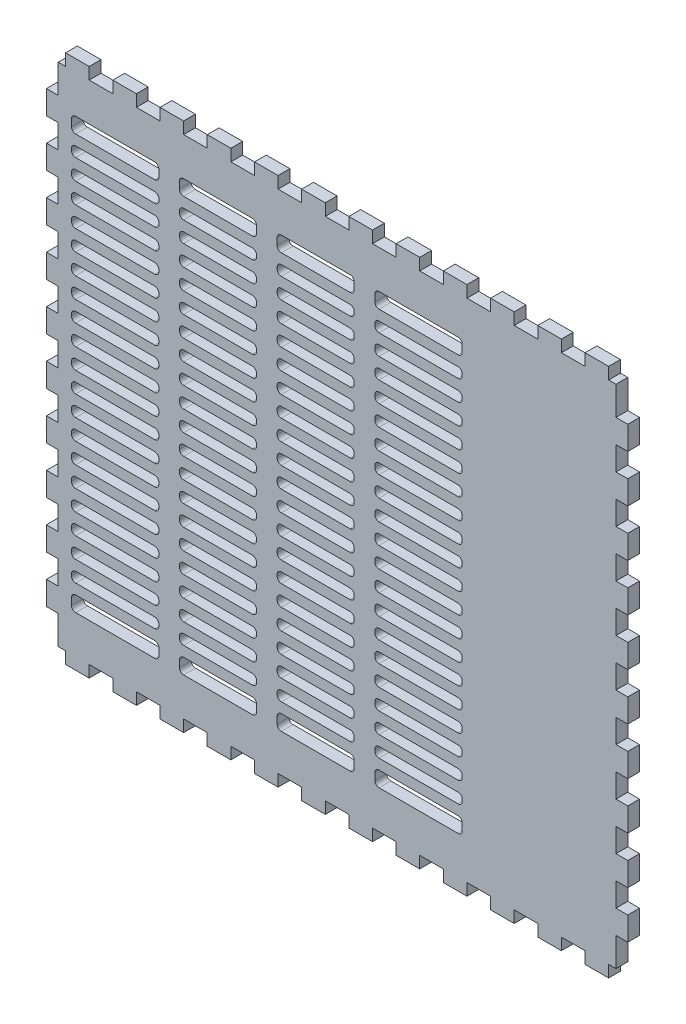
from build123d import *

# Parameters (mm, degrees)
BOSS_EXTRUDE1_DEPTH = 5.715
VENT1_DEPTH         = 5.715
FILLET1_R           = 2


# Read off the part's stored shape, not the designer's step: Vent1
with BuildPart() as part:
    # Model → Boss-Extrude1 (new body)
    with BuildSketch(Plane.XY):
        Polygon((584.69022, 28.91536), (588.24368, 28.91536), (588.24368, 23.2006394), (599.67622, 23.2006394), (599.67622, 28.91536), (611.10622, 28.91536), (611.10622, 23.2006394), (622.53622, 23.2006394), (622.53622, 28.91536), (633.96622, 28.91536), (633.96622, 23.2006394), (645.39368, 23.2006394), (645.39368, 28.91536), (656.82622, 28.91536), (656.82622, 23.2006394), (668.25622, 23.2006394), (668.25622, 28.91536), (679.68622, 28.91536), (679.68622, 23.2006394), (691.11622, 23.2006394), (691.11622, 28.91536), (702.54368, 28.91536), (702.54368, 23.2006394), (713.97622, 23.2006394), (713.97622, 28.91536), (725.40622, 28.91536), (725.40622, 23.2006394), (736.83622, 23.2006394), (736.83622, 28.91536), (748.26622, 28.91536), (748.26622, 23.2006394), (759.69368, 23.2006394), (759.69368, 28.91536), (771.12622, 28.91536), (771.12622, 23.2006394), (782.55622, 23.2006394), (782.55622, 28.91536), (793.98622, 28.91536), (793.98622, 23.2006394), (805.41622, 23.2006394), (805.41622, 28.91536), (816.84368, 28.91536), (816.84368, 23.2006394), (828.27622, 23.2006394), (828.27622, 28.91536), (839.70622, 28.91536), (839.70622, 23.2006394), (851.13622, 23.2006394), (851.13622, 28.91536), (854.68968, 28.91536), (854.68968, 42.83075), (860.40468, 42.83075), (860.40468, 54.260496), (854.68968, 54.260496), (854.68968, 65.691004), (860.40468, 65.691004), (860.40468, 77.120496), (854.68968, 77.120496), (854.68968, 88.549988), (860.40468, 88.549988), (860.40468, 99.98075), (854.68968, 99.98075), (854.68968, 111.410496), (860.40468, 111.410496), (860.40468, 122.841004), (854.68968, 122.841004), (854.68968, 134.270496), (860.40468, 134.270496), (860.40468, 145.699988), (854.68968, 145.699988), (854.68968, 157.13075), (860.40468, 157.13075), (860.40468, 168.560496), (854.68968, 168.560496), (854.68968, 179.991004), (860.40468, 179.991004), (860.40468, 191.420496), (854.68968, 191.420496), (854.68968, 202.849988), (860.40468, 202.849988), (860.40468, 214.28075), (854.68968, 214.28075), (854.68968, 225.710496), (860.40468, 225.710496), (860.40468, 237.141004), (854.68968, 237.141004), (854.68968, 248.570496), (860.40468, 248.570496), (860.40468, 259.99948), (854.68968, 259.99948), (854.68968, 273.91614), (851.13622, 273.91614), (851.13622, 279.63114), (839.70622, 279.63114), (839.70622, 273.91614), (828.27622, 273.91614), (828.27622, 279.63114), (816.84368, 279.63114), (816.84368, 273.91614), (805.41622, 273.91614), (805.41622, 279.63114), (793.98622, 279.63114), (793.98622, 273.91614), (782.55622, 273.91614), (782.55622, 279.63114), (771.12622, 279.63114), (771.12622, 273.91614), (759.69368, 273.91614), (759.69368, 279.63114), (748.26622, 279.63114), (748.26622, 273.91614), (736.83622, 273.91614), (736.83622, 279.63114), (725.40622, 279.63114), (725.40622, 273.91614), (713.97622, 273.91614), (713.97622, 279.63114), (702.54368, 279.63114), (702.54368, 273.91614), (691.11622, 273.91614), (691.11622, 279.63114), (679.68622, 279.63114), (679.68622, 273.91614), (668.25622, 273.91614), (668.25622, 279.63114), (656.82622, 279.63114), (656.82622, 273.91614), (645.39368, 273.91614), (645.39368, 279.63114), (633.96622, 279.63114), (633.96622, 273.91614), (622.53622, 273.91614), (622.53622, 279.63114), (611.10622, 279.63114), (611.10622, 273.91614), (599.67622, 273.91614), (599.67622, 279.63114), (588.24368, 279.63114), (588.24368, 273.91614), (584.69022, 273.91614), (584.69022, 259.99948), (578.97522, 259.99948), (578.97522, 248.570496), (584.69022, 248.570496), (584.69022, 237.141004), (578.97522, 237.141004), (578.97522, 225.710496), (584.69022, 225.710496), (584.69022, 214.28075), (578.97522, 214.28075), (578.97522, 202.849988), (584.69022, 202.849988), (584.69022, 191.420496), (578.97522, 191.420496), (578.97522, 179.991004), (584.69022, 179.991004), (584.69022, 168.560496), (578.97522, 168.560496), (578.97522, 157.13075), (584.69022, 157.13075), (584.69022, 145.699988), (578.97522, 145.699988), (578.97522, 134.270496), (584.69022, 134.270496), (584.69022, 122.841004), (578.97522, 122.841004), (578.97522, 111.410496), (584.69022, 111.410496), (584.69022, 99.98075), (578.97522, 99.98075), (578.97522, 88.549988), (584.69022, 88.549988), (584.69022, 77.120496), (578.97522, 77.120496), (578.97522, 65.691004), (584.69022, 65.691004), (584.69022, 54.260496), (578.97522, 54.260496), (578.97522, 42.83075), (584.69022, 42.83075), align=None)
    extrude(amount=BOSS_EXTRUDE1_DEPTH)

    # Vent1 outline → Vent1 (cut)
    with BuildSketch(Plane.XY):
        with BuildLine():
            ThreePointArc((633.397453047, 253.451283906), (632.811666609, 254.865497468), (631.397453047, 255.451283906))
            Line((631.397453047, 255.451283906), (591.104686094, 255.451283906))
            Line((591.104686094, 255.451283906), (591.104686094, 250.04313782))
            ThreePointArc((591.104686094, 250.04313782), (591.690472532, 248.628924257), (593.104686094, 248.04313782))
            Line((593.104686094, 248.04313782), (631.397453047, 248.04313782))
            ThreePointArc((631.397453047, 248.04313782), (632.811666609, 248.628924257), (633.397453047, 250.04313782))
            Line((633.397453047, 250.04313782), (633.397453047, 253.451283906))
        make_face()
        with BuildLine():
            ThreePointArc((680.69022, 253.451283906), (680.104433562, 254.865497468), (678.69022, 255.451283906))
            Line((678.69022, 255.451283906), (645.397453047, 255.451283906))
            ThreePointArc((645.397453047, 255.451283906), (643.983239485, 254.865497468), (643.397453047, 253.451283906))
            Line((643.397453047, 253.451283906), (643.397453047, 250.04313782))
            ThreePointArc((643.397453047, 250.04313782), (643.983239485, 248.628924257), (645.397453047, 248.04313782))
            Line((645.397453047, 248.04313782), (678.69022, 248.04313782))
            ThreePointArc((678.69022, 248.04313782), (680.104433562, 248.628924257), (680.69022, 250.04313782))
            Line((680.69022, 250.04313782), (680.69022, 253.451283906))
        make_face()
        with BuildLine():
            ThreePointArc((727.982986953, 253.451283906), (727.397200515, 254.865497468), (725.982986953, 255.451283906))
            Line((725.982986953, 255.451283906), (692.69022, 255.451283906))
            ThreePointArc((692.69022, 255.451283906), (691.276006438, 254.865497468), (690.69022, 253.451283906))
            Line((690.69022, 253.451283906), (690.69022, 250.04313782))
            ThreePointArc((690.69022, 250.04313782), (691.276006437, 248.628924257), (692.69022, 248.04313782))
            Line((692.69022, 248.04313782), (725.982986953, 248.04313782))
            ThreePointArc((725.982986953, 248.04313782), (727.397200516, 248.628924257), (727.982986953, 250.04313782))
            Line((727.982986953, 250.04313782), (727.982986953, 253.451283906))
        make_face()
        with BuildLine():
            Line((780.275753906, 250.04313782), (780.275753906, 255.451283906))
            Line((780.275753906, 255.451283906), (739.982986953, 255.451283906))
            ThreePointArc((739.982986953, 255.451283906), (738.568773391, 254.865497468), (737.982986953, 253.451283906))
            Line((737.982986953, 253.451283906), (737.982986953, 250.04313782))
            ThreePointArc((737.982986953, 250.04313782), (738.568773391, 248.628924257), (739.982986953, 248.04313782))
            Line((739.982986953, 248.04313782), (778.275753906, 248.04313782))
            ThreePointArc((778.275753906, 248.04313782), (779.689967468, 248.628924257), (780.275753906, 250.04313782))
        make_face()
        with BuildLine():
            Line((591.104686094, 52.78836218), (591.104686094, 47.380216094))
            Line((591.104686094, 47.380216094), (631.397453047, 47.380216094))
            ThreePointArc((631.397453047, 47.380216094), (632.811666609, 47.966002532), (633.397453047, 49.380216094))
            Line((633.397453047, 49.380216094), (633.397453047, 52.78836218))
            ThreePointArc((633.397453047, 52.78836218), (632.811666609, 54.202575742), (631.397453047, 54.78836218))
            Line((631.397453047, 54.78836218), (593.104686094, 54.78836218))
            ThreePointArc((593.104686094, 54.78836218), (591.690472532, 54.202575743), (591.104686094, 52.78836218))
        make_face()
        with BuildLine():
            ThreePointArc((643.397453047, 49.380216094), (643.983239485, 47.966002532), (645.397453047, 47.380216094))
            Line((645.397453047, 47.380216094), (678.69022, 47.380216094))
            ThreePointArc((678.69022, 47.380216094), (680.104433562, 47.966002532), (680.69022, 49.380216094))
            Line((680.69022, 49.380216094), (680.69022, 52.78836218))
            ThreePointArc((680.69022, 52.78836218), (680.104433562, 54.202575743), (678.69022, 54.78836218))
            Line((678.69022, 54.78836218), (645.397453047, 54.78836218))
            ThreePointArc((645.397453047, 54.78836218), (643.983239485, 54.202575742), (643.397453047, 52.78836218))
            Line((643.397453047, 52.78836218), (643.397453047, 49.380216094))
        make_face()
        with BuildLine():
            ThreePointArc((690.69022, 49.380216094), (691.276006438, 47.966002532), (692.69022, 47.380216094))
            Line((692.69022, 47.380216094), (725.982986953, 47.380216094))
            ThreePointArc((725.982986953, 47.380216094), (727.397200515, 47.966002532), (727.982986953, 49.380216094))
            Line((727.982986953, 49.380216094), (727.982986953, 52.78836218))
            ThreePointArc((727.982986953, 52.78836218), (727.397200516, 54.202575742), (725.982986953, 54.78836218))
            Line((725.982986953, 54.78836218), (692.69022, 54.78836218))
            ThreePointArc((692.69022, 54.78836218), (691.276006437, 54.202575742), (690.69022, 52.78836218))
            Line((690.69022, 52.78836218), (690.69022, 49.380216094))
        make_face()
        with BuildLine():
            ThreePointArc((737.982986953, 49.380216094), (738.568773391, 47.966002532), (739.982986953, 47.380216094))
            Line((739.982986953, 47.380216094), (780.275753906, 47.380216094))
            Line((780.275753906, 47.380216094), (780.275753906, 52.78836218))
            ThreePointArc((780.275753906, 52.78836218), (779.689967468, 54.202575742), (778.275753906, 54.78836218))
            Line((778.275753906, 54.78836218), (739.982986953, 54.78836218))
            ThreePointArc((739.982986953, 54.78836218), (738.568773391, 54.202575742), (737.982986953, 52.78836218))
            Line((737.982986953, 52.78836218), (737.982986953, 49.380216094))
        make_face()
        with BuildLine():
            Line((593.104686094, 59.78836218), (631.397453047, 59.78836218))
            ThreePointArc((631.397453047, 59.78836218), (632.811666609, 60.374148618), (633.397453047, 61.78836218))
            Line((633.397453047, 61.78836218), (633.397453047, 62.696508267))
            ThreePointArc((633.397453047, 62.696508267), (632.811666609, 64.110721829), (631.397453047, 64.696508267))
            Line((631.397453047, 64.696508267), (593.104686094, 64.696508267))
            ThreePointArc((593.104686094, 64.696508267), (591.690472532, 64.110721829), (591.104686094, 62.696508267))
            Line((591.104686094, 62.696508267), (591.104686094, 61.78836218))
            ThreePointArc((591.104686094, 61.78836218), (591.690472532, 60.374148618), (593.104686094, 59.78836218))
        make_face()
        with BuildLine():
            Line((645.397453047, 59.78836218), (678.69022, 59.78836218))
            ThreePointArc((678.69022, 59.78836218), (680.104433562, 60.374148618), (680.69022, 61.78836218))
            Line((680.69022, 61.78836218), (680.69022, 62.696508267))
            ThreePointArc((680.69022, 62.696508267), (680.104433562, 64.110721829), (678.69022, 64.696508267))
            Line((678.69022, 64.696508267), (645.397453047, 64.696508267))
            ThreePointArc((645.397453047, 64.696508267), (643.983239485, 64.110721829), (643.397453047, 62.696508267))
            Line((643.397453047, 62.696508267), (643.397453047, 61.78836218))
            ThreePointArc((643.397453047, 61.78836218), (643.983239485, 60.374148618), (645.397453047, 59.78836218))
        make_face()
        with BuildLine():
            Line((692.69022, 59.78836218), (725.982986953, 59.78836218))
            ThreePointArc((725.982986953, 59.78836218), (727.397200515, 60.374148618), (727.982986953, 61.78836218))
            Line((727.982986953, 61.78836218), (727.982986953, 62.696508267))
            ThreePointArc((727.982986953, 62.696508267), (727.397200515, 64.110721829), (725.982986953, 64.696508267))
            Line((725.982986953, 64.696508267), (692.69022, 64.696508267))
            ThreePointArc((692.69022, 64.696508267), (691.276006438, 64.110721829), (690.69022, 62.696508267))
            Line((690.69022, 62.696508267), (690.69022, 61.78836218))
            ThreePointArc((690.69022, 61.78836218), (691.276006438, 60.374148618), (692.69022, 59.78836218))
        make_face()
        with BuildLine():
            Line((739.982986953, 59.78836218), (778.275753906, 59.78836218))
            ThreePointArc((778.275753906, 59.78836218), (779.689967468, 60.374148618), (780.275753906, 61.78836218))
            Line((780.275753906, 61.78836218), (780.275753906, 62.696508267))
            ThreePointArc((780.275753906, 62.696508267), (779.689967468, 64.110721829), (778.275753906, 64.696508267))
            Line((778.275753906, 64.696508267), (739.982986953, 64.696508267))
            ThreePointArc((739.982986953, 64.696508267), (738.568773391, 64.110721829), (737.982986953, 62.696508267))
            Line((737.982986953, 62.696508267), (737.982986953, 61.78836218))
            ThreePointArc((737.982986953, 61.78836218), (738.568773391, 60.374148618), (739.982986953, 59.78836218))
        make_face()
        with BuildLine():
            Line((593.104686094, 69.696508267), (631.397453047, 69.696508267))
            ThreePointArc((631.397453047, 69.696508267), (632.811666609, 70.282294705), (633.397453047, 71.696508267))
            Line((633.397453047, 71.696508267), (633.397453047, 72.604654353))
            ThreePointArc((633.397453047, 72.604654353), (632.811666609, 74.018867915), (631.397453047, 74.604654353))
            Line((631.397453047, 74.604654353), (593.104686094, 74.604654353))
            ThreePointArc((593.104686094, 74.604654353), (591.690472532, 74.018867915), (591.104686094, 72.604654353))
            Line((591.104686094, 72.604654353), (591.104686094, 71.696508267))
            ThreePointArc((591.104686094, 71.696508267), (591.690472532, 70.282294704), (593.104686094, 69.696508267))
        make_face()
        with BuildLine():
            Line((645.397453047, 69.696508267), (678.69022, 69.696508267))
            ThreePointArc((678.69022, 69.696508267), (680.104433562, 70.282294704), (680.69022, 71.696508267))
            Line((680.69022, 71.696508267), (680.69022, 72.604654353))
            ThreePointArc((680.69022, 72.604654353), (680.104433562, 74.018867915), (678.69022, 74.604654353))
            Line((678.69022, 74.604654353), (645.397453047, 74.604654353))
            ThreePointArc((645.397453047, 74.604654353), (643.983239485, 74.018867915), (643.397453047, 72.604654353))
            Line((643.397453047, 72.604654353), (643.397453047, 71.696508267))
            ThreePointArc((643.397453047, 71.696508267), (643.983239485, 70.282294705), (645.397453047, 69.696508267))
        make_face()
        with BuildLine():
            Line((692.69022, 69.696508267), (725.982986953, 69.696508267))
            ThreePointArc((725.982986953, 69.696508267), (727.397200516, 70.282294705), (727.982986953, 71.696508267))
            Line((727.982986953, 71.696508267), (727.982986953, 72.604654353))
            ThreePointArc((727.982986953, 72.604654353), (727.397200515, 74.018867915), (725.982986953, 74.604654353))
            Line((725.982986953, 74.604654353), (692.69022, 74.604654353))
            ThreePointArc((692.69022, 74.604654353), (691.276006438, 74.018867915), (690.69022, 72.604654353))
            Line((690.69022, 72.604654353), (690.69022, 71.696508267))
            ThreePointArc((690.69022, 71.696508267), (691.276006437, 70.282294705), (692.69022, 69.696508267))
        make_face()
        with BuildLine():
            Line((739.982986953, 69.696508267), (778.275753906, 69.696508267))
            ThreePointArc((778.275753906, 69.696508267), (779.689967468, 70.282294705), (780.275753906, 71.696508267))
            Line((780.275753906, 71.696508267), (780.275753906, 72.604654353))
            ThreePointArc((780.275753906, 72.604654353), (779.689967468, 74.018867915), (778.275753906, 74.604654353))
            Line((778.275753906, 74.604654353), (739.982986953, 74.604654353))
            ThreePointArc((739.982986953, 74.604654353), (738.568773391, 74.018867915), (737.982986953, 72.604654353))
            Line((737.982986953, 72.604654353), (737.982986953, 71.696508267))
            ThreePointArc((737.982986953, 71.696508267), (738.568773391, 70.282294705), (739.982986953, 69.696508267))
        make_face()
        with BuildLine():
            Line((593.104686094, 79.604654353), (631.397453047, 79.604654353))
            ThreePointArc((631.397453047, 79.604654353), (632.811666609, 80.190440791), (633.397453047, 81.604654353))
            Line((633.397453047, 81.604654353), (633.397453047, 82.512800439))
            ThreePointArc((633.397453047, 82.512800439), (632.811666609, 83.927014001), (631.397453047, 84.512800439))
            Line((631.397453047, 84.512800439), (593.104686094, 84.512800439))
            ThreePointArc((593.104686094, 84.512800439), (591.690472532, 83.927014002), (591.104686094, 82.512800439))
            Line((591.104686094, 82.512800439), (591.104686094, 81.604654353))
            ThreePointArc((591.104686094, 81.604654353), (591.690472532, 80.190440791), (593.104686094, 79.604654353))
        make_face()
        with BuildLine():
            Line((645.397453047, 79.604654353), (678.69022, 79.604654353))
            ThreePointArc((678.69022, 79.604654353), (680.104433562, 80.190440791), (680.69022, 81.604654353))
            Line((680.69022, 81.604654353), (680.69022, 82.512800439))
            ThreePointArc((680.69022, 82.512800439), (680.104433562, 83.927014002), (678.69022, 84.512800439))
            Line((678.69022, 84.512800439), (645.397453047, 84.512800439))
            ThreePointArc((645.397453047, 84.512800439), (643.983239485, 83.927014001), (643.397453047, 82.512800439))
            Line((643.397453047, 82.512800439), (643.397453047, 81.604654353))
            ThreePointArc((643.397453047, 81.604654353), (643.983239485, 80.190440791), (645.397453047, 79.604654353))
        make_face()
        with BuildLine():
            Line((692.69022, 79.604654353), (725.982986953, 79.604654353))
            ThreePointArc((725.982986953, 79.604654353), (727.397200515, 80.190440791), (727.982986953, 81.604654353))
            Line((727.982986953, 81.604654353), (727.982986953, 82.512800439))
            ThreePointArc((727.982986953, 82.512800439), (727.397200516, 83.927014001), (725.982986953, 84.512800439))
            Line((725.982986953, 84.512800439), (692.69022, 84.512800439))
            ThreePointArc((692.69022, 84.512800439), (691.276006437, 83.927014001), (690.69022, 82.512800439))
            Line((690.69022, 82.512800439), (690.69022, 81.604654353))
            ThreePointArc((690.69022, 81.604654353), (691.276006438, 80.190440791), (692.69022, 79.604654353))
        make_face()
        with BuildLine():
            Line((739.982986953, 79.604654353), (778.275753906, 79.604654353))
            ThreePointArc((778.275753906, 79.604654353), (779.689967468, 80.190440791), (780.275753906, 81.604654353))
            Line((780.275753906, 81.604654353), (780.275753906, 82.512800439))
            ThreePointArc((780.275753906, 82.512800439), (779.689967468, 83.927014001), (778.275753906, 84.512800439))
            Line((778.275753906, 84.512800439), (739.982986953, 84.512800439))
            ThreePointArc((739.982986953, 84.512800439), (738.568773391, 83.927014001), (737.982986953, 82.512800439))
            Line((737.982986953, 82.512800439), (737.982986953, 81.604654353))
            ThreePointArc((737.982986953, 81.604654353), (738.568773391, 80.190440791), (739.982986953, 79.604654353))
        make_face()
        with BuildLine():
            Line((593.104686094, 89.512800439), (631.397453047, 89.512800439))
            ThreePointArc((631.397453047, 89.512800439), (632.811666609, 90.098586877), (633.397453047, 91.512800439))
            Line((633.397453047, 91.512800439), (633.397453047, 92.420946525))
            ThreePointArc((633.397453047, 92.420946525), (632.811666609, 93.835160087), (631.397453047, 94.420946525))
            Line((631.397453047, 94.420946525), (593.104686094, 94.420946525))
            ThreePointArc((593.104686094, 94.420946525), (591.690472532, 93.835160088), (591.104686094, 92.420946525))
            Line((591.104686094, 92.420946525), (591.104686094, 91.512800439))
            ThreePointArc((591.104686094, 91.512800439), (591.690472532, 90.098586877), (593.104686094, 89.512800439))
        make_face()
        with BuildLine():
            Line((645.397453047, 89.512800439), (678.69022, 89.512800439))
            ThreePointArc((678.69022, 89.512800439), (680.104433562, 90.098586877), (680.69022, 91.512800439))
            Line((680.69022, 91.512800439), (680.69022, 92.420946525))
            ThreePointArc((680.69022, 92.420946525), (680.104433562, 93.835160088), (678.69022, 94.420946525))
            Line((678.69022, 94.420946525), (645.397453047, 94.420946525))
            ThreePointArc((645.397453047, 94.420946525), (643.983239485, 93.835160087), (643.397453047, 92.420946525))
            Line((643.397453047, 92.420946525), (643.397453047, 91.512800439))
            ThreePointArc((643.397453047, 91.512800439), (643.983239485, 90.098586877), (645.397453047, 89.512800439))
        make_face()
        with BuildLine():
            Line((692.69022, 89.512800439), (725.982986953, 89.512800439))
            ThreePointArc((725.982986953, 89.512800439), (727.397200515, 90.098586877), (727.982986953, 91.512800439))
            Line((727.982986953, 91.512800439), (727.982986953, 92.420946525))
            ThreePointArc((727.982986953, 92.420946525), (727.397200516, 93.835160087), (725.982986953, 94.420946525))
            Line((725.982986953, 94.420946525), (692.69022, 94.420946525))
            ThreePointArc((692.69022, 94.420946525), (691.276006437, 93.835160087), (690.69022, 92.420946525))
            Line((690.69022, 92.420946525), (690.69022, 91.512800439))
            ThreePointArc((690.69022, 91.512800439), (691.276006438, 90.098586877), (692.69022, 89.512800439))
        make_face()
        with BuildLine():
            Line((739.982986953, 89.512800439), (778.275753906, 89.512800439))
            ThreePointArc((778.275753906, 89.512800439), (779.689967468, 90.098586877), (780.275753906, 91.512800439))
            Line((780.275753906, 91.512800439), (780.275753906, 92.420946525))
            ThreePointArc((780.275753906, 92.420946525), (779.689967468, 93.835160087), (778.275753906, 94.420946525))
            Line((778.275753906, 94.420946525), (739.982986953, 94.420946525))
            ThreePointArc((739.982986953, 94.420946525), (738.568773391, 93.835160087), (737.982986953, 92.420946525))
            Line((737.982986953, 92.420946525), (737.982986953, 91.512800439))
            ThreePointArc((737.982986953, 91.512800439), (738.568773391, 90.098586877), (739.982986953, 89.512800439))
        make_face()
        with BuildLine():
            Line((593.104686094, 99.420946525), (631.397453047, 99.420946525))
            ThreePointArc((631.397453047, 99.420946525), (632.811666609, 100.006732963), (633.397453047, 101.420946525))
            Line((633.397453047, 101.420946525), (633.397453047, 102.329092612))
            ThreePointArc((633.397453047, 102.329092612), (632.811666609, 103.743306174), (631.397453047, 104.329092612))
            Line((631.397453047, 104.329092612), (593.104686094, 104.329092612))
            ThreePointArc((593.104686094, 104.329092612), (591.690472532, 103.743306174), (591.104686094, 102.329092612))
            Line((591.104686094, 102.329092612), (591.104686094, 101.420946525))
            ThreePointArc((591.104686094, 101.420946525), (591.690472532, 100.006732963), (593.104686094, 99.420946525))
        make_face()
        with BuildLine():
            Line((645.397453047, 99.420946525), (678.69022, 99.420946525))
            ThreePointArc((678.69022, 99.420946525), (680.104433562, 100.006732963), (680.69022, 101.420946525))
            Line((680.69022, 101.420946525), (680.69022, 102.329092612))
            ThreePointArc((680.69022, 102.329092612), (680.104433562, 103.743306174), (678.69022, 104.329092612))
            Line((678.69022, 104.329092612), (645.397453047, 104.329092612))
            ThreePointArc((645.397453047, 104.329092612), (643.983239485, 103.743306174), (643.397453047, 102.329092612))
            Line((643.397453047, 102.329092612), (643.397453047, 101.420946525))
            ThreePointArc((643.397453047, 101.420946525), (643.983239485, 100.006732963), (645.397453047, 99.420946525))
        make_face()
        with BuildLine():
            Line((692.69022, 99.420946525), (725.982986953, 99.420946525))
            ThreePointArc((725.982986953, 99.420946525), (727.397200515, 100.006732963), (727.982986953, 101.420946525))
            Line((727.982986953, 101.420946525), (727.982986953, 102.329092612))
            ThreePointArc((727.982986953, 102.329092612), (727.397200515, 103.743306174), (725.982986953, 104.329092612))
            Line((725.982986953, 104.329092612), (692.69022, 104.329092612))
            ThreePointArc((692.69022, 104.329092612), (691.276006438, 103.743306174), (690.69022, 102.329092612))
            Line((690.69022, 102.329092612), (690.69022, 101.420946525))
            ThreePointArc((690.69022, 101.420946525), (691.276006438, 100.006732963), (692.69022, 99.420946525))
        make_face()
        with BuildLine():
            Line((739.982986953, 99.420946525), (778.275753906, 99.420946525))
            ThreePointArc((778.275753906, 99.420946525), (779.689967468, 100.006732963), (780.275753906, 101.420946525))
            Line((780.275753906, 101.420946525), (780.275753906, 102.329092612))
            ThreePointArc((780.275753906, 102.329092612), (779.689967468, 103.743306174), (778.275753906, 104.329092612))
            Line((778.275753906, 104.329092612), (739.982986953, 104.329092612))
            ThreePointArc((739.982986953, 104.329092612), (738.568773391, 103.743306174), (737.982986953, 102.329092612))
            Line((737.982986953, 102.329092612), (737.982986953, 101.420946525))
            ThreePointArc((737.982986953, 101.420946525), (738.568773391, 100.006732963), (739.982986953, 99.420946525))
        make_face()
        with BuildLine():
            Line((593.104686094, 109.329092612), (631.397453047, 109.329092612))
            ThreePointArc((631.397453047, 109.329092612), (632.811666609, 109.91487905), (633.397453047, 111.329092612))
            Line((633.397453047, 111.329092612), (633.397453047, 112.237238698))
            ThreePointArc((633.397453047, 112.237238698), (632.811666609, 113.65145226), (631.397453047, 114.237238698))
            Line((631.397453047, 114.237238698), (593.104686094, 114.237238698))
            ThreePointArc((593.104686094, 114.237238698), (591.690472532, 113.65145226), (591.104686094, 112.237238698))
            Line((591.104686094, 112.237238698), (591.104686094, 111.329092612))
            ThreePointArc((591.104686094, 111.329092612), (591.690472532, 109.914879049), (593.104686094, 109.329092612))
        make_face()
        with BuildLine():
            Line((645.397453047, 109.329092612), (678.69022, 109.329092612))
            ThreePointArc((678.69022, 109.329092612), (680.104433562, 109.914879049), (680.69022, 111.329092612))
            Line((680.69022, 111.329092612), (680.69022, 112.237238698))
            ThreePointArc((680.69022, 112.237238698), (680.104433562, 113.65145226), (678.69022, 114.237238698))
            Line((678.69022, 114.237238698), (645.397453047, 114.237238698))
            ThreePointArc((645.397453047, 114.237238698), (643.983239485, 113.65145226), (643.397453047, 112.237238698))
            Line((643.397453047, 112.237238698), (643.397453047, 111.329092612))
            ThreePointArc((643.397453047, 111.329092612), (643.983239485, 109.91487905), (645.397453047, 109.329092612))
        make_face()
        with BuildLine():
            Line((692.69022, 109.329092612), (725.982986953, 109.329092612))
            ThreePointArc((725.982986953, 109.329092612), (727.397200516, 109.91487905), (727.982986953, 111.329092612))
            Line((727.982986953, 111.329092612), (727.982986953, 112.237238698))
            ThreePointArc((727.982986953, 112.237238698), (727.397200515, 113.65145226), (725.982986953, 114.237238698))
            Line((725.982986953, 114.237238698), (692.69022, 114.237238698))
            ThreePointArc((692.69022, 114.237238698), (691.276006438, 113.65145226), (690.69022, 112.237238698))
            Line((690.69022, 112.237238698), (690.69022, 111.329092612))
            ThreePointArc((690.69022, 111.329092612), (691.276006437, 109.91487905), (692.69022, 109.329092612))
        make_face()
        with BuildLine():
            Line((739.982986953, 109.329092612), (778.275753906, 109.329092612))
            ThreePointArc((778.275753906, 109.329092612), (779.689967468, 109.91487905), (780.275753906, 111.329092612))
            Line((780.275753906, 111.329092612), (780.275753906, 112.237238698))
            ThreePointArc((780.275753906, 112.237238698), (779.689967468, 113.65145226), (778.275753906, 114.237238698))
            Line((778.275753906, 114.237238698), (739.982986953, 114.237238698))
            ThreePointArc((739.982986953, 114.237238698), (738.568773391, 113.65145226), (737.982986953, 112.237238698))
            Line((737.982986953, 112.237238698), (737.982986953, 111.329092612))
            ThreePointArc((737.982986953, 111.329092612), (738.568773391, 109.91487905), (739.982986953, 109.329092612))
        make_face()
        with BuildLine():
            Line((593.104686094, 119.237238698), (631.397453047, 119.237238698))
            ThreePointArc((631.397453047, 119.237238698), (632.811666609, 119.823025136), (633.397453047, 121.237238698))
            Line((633.397453047, 121.237238698), (633.397453047, 122.145384784))
            ThreePointArc((633.397453047, 122.145384784), (632.811666609, 123.559598346), (631.397453047, 124.145384784))
            Line((631.397453047, 124.145384784), (593.104686094, 124.145384784))
            ThreePointArc((593.104686094, 124.145384784), (591.690472532, 123.559598347), (591.104686094, 122.145384784))
            Line((591.104686094, 122.145384784), (591.104686094, 121.237238698))
            ThreePointArc((591.104686094, 121.237238698), (591.690472532, 119.823025136), (593.104686094, 119.237238698))
        make_face()
        with BuildLine():
            Line((645.397453047, 119.237238698), (678.69022, 119.237238698))
            ThreePointArc((678.69022, 119.237238698), (680.104433562, 119.823025136), (680.69022, 121.237238698))
            Line((680.69022, 121.237238698), (680.69022, 122.145384784))
            ThreePointArc((680.69022, 122.145384784), (680.104433562, 123.559598347), (678.69022, 124.145384784))
            Line((678.69022, 124.145384784), (645.397453047, 124.145384784))
            ThreePointArc((645.397453047, 124.145384784), (643.983239485, 123.559598346), (643.397453047, 122.145384784))
            Line((643.397453047, 122.145384784), (643.397453047, 121.237238698))
            ThreePointArc((643.397453047, 121.237238698), (643.983239485, 119.823025136), (645.397453047, 119.237238698))
        make_face()
        with BuildLine():
            Line((692.69022, 119.237238698), (725.982986953, 119.237238698))
            ThreePointArc((725.982986953, 119.237238698), (727.397200515, 119.823025136), (727.982986953, 121.237238698))
            Line((727.982986953, 121.237238698), (727.982986953, 122.145384784))
            ThreePointArc((727.982986953, 122.145384784), (727.397200516, 123.559598346), (725.982986953, 124.145384784))
            Line((725.982986953, 124.145384784), (692.69022, 124.145384784))
            ThreePointArc((692.69022, 124.145384784), (691.276006437, 123.559598346), (690.69022, 122.145384784))
            Line((690.69022, 122.145384784), (690.69022, 121.237238698))
            ThreePointArc((690.69022, 121.237238698), (691.276006438, 119.823025136), (692.69022, 119.237238698))
        make_face()
        with BuildLine():
            Line((739.982986953, 119.237238698), (778.275753906, 119.237238698))
            ThreePointArc((778.275753906, 119.237238698), (779.689967468, 119.823025136), (780.275753906, 121.237238698))
            Line((780.275753906, 121.237238698), (780.275753906, 122.145384784))
            ThreePointArc((780.275753906, 122.145384784), (779.689967468, 123.559598346), (778.275753906, 124.145384784))
            Line((778.275753906, 124.145384784), (739.982986953, 124.145384784))
            ThreePointArc((739.982986953, 124.145384784), (738.568773391, 123.559598346), (737.982986953, 122.145384784))
            Line((737.982986953, 122.145384784), (737.982986953, 121.237238698))
            ThreePointArc((737.982986953, 121.237238698), (738.568773391, 119.823025136), (739.982986953, 119.237238698))
        make_face()
        with BuildLine():
            Line((593.104686094, 129.145384784), (631.397453047, 129.145384784))
            ThreePointArc((631.397453047, 129.145384784), (632.811666609, 129.731171222), (633.397453047, 131.145384784))
            Line((633.397453047, 131.145384784), (633.397453047, 132.053530871))
            ThreePointArc((633.397453047, 132.053530871), (632.811666609, 133.467744433), (631.397453047, 134.053530871))
            Line((631.397453047, 134.053530871), (593.104686094, 134.053530871))
            ThreePointArc((593.104686094, 134.053530871), (591.690472532, 133.467744433), (591.104686094, 132.053530871))
            Line((591.104686094, 132.053530871), (591.104686094, 131.145384784))
            ThreePointArc((591.104686094, 131.145384784), (591.690472532, 129.731171222), (593.104686094, 129.145384784))
        make_face()
        with BuildLine():
            Line((645.397453047, 129.145384784), (678.69022, 129.145384784))
            ThreePointArc((678.69022, 129.145384784), (680.104433562, 129.731171222), (680.69022, 131.145384784))
            Line((680.69022, 131.145384784), (680.69022, 132.053530871))
            ThreePointArc((680.69022, 132.053530871), (680.104433562, 133.467744433), (678.69022, 134.053530871))
            Line((678.69022, 134.053530871), (645.397453047, 134.053530871))
            ThreePointArc((645.397453047, 134.053530871), (643.983239485, 133.467744433), (643.397453047, 132.053530871))
            Line((643.397453047, 132.053530871), (643.397453047, 131.145384784))
            ThreePointArc((643.397453047, 131.145384784), (643.983239485, 129.731171222), (645.397453047, 129.145384784))
        make_face()
        with BuildLine():
            Line((692.69022, 129.145384784), (725.982986953, 129.145384784))
            ThreePointArc((725.982986953, 129.145384784), (727.397200515, 129.731171222), (727.982986953, 131.145384784))
            Line((727.982986953, 131.145384784), (727.982986953, 132.053530871))
            ThreePointArc((727.982986953, 132.053530871), (727.397200515, 133.467744433), (725.982986953, 134.053530871))
            Line((725.982986953, 134.053530871), (692.69022, 134.053530871))
            ThreePointArc((692.69022, 134.053530871), (691.276006438, 133.467744433), (690.69022, 132.053530871))
            Line((690.69022, 132.053530871), (690.69022, 131.145384784))
            ThreePointArc((690.69022, 131.145384784), (691.276006438, 129.731171222), (692.69022, 129.145384784))
        make_face()
        with BuildLine():
            Line((739.982986953, 129.145384784), (778.275753906, 129.145384784))
            ThreePointArc((778.275753906, 129.145384784), (779.689967468, 129.731171222), (780.275753906, 131.145384784))
            Line((780.275753906, 131.145384784), (780.275753906, 132.053530871))
            ThreePointArc((780.275753906, 132.053530871), (779.689967468, 133.467744433), (778.275753906, 134.053530871))
            Line((778.275753906, 134.053530871), (739.982986953, 134.053530871))
            ThreePointArc((739.982986953, 134.053530871), (738.568773391, 133.467744433), (737.982986953, 132.053530871))
            Line((737.982986953, 132.053530871), (737.982986953, 131.145384784))
            ThreePointArc((737.982986953, 131.145384784), (738.568773391, 129.731171222), (739.982986953, 129.145384784))
        make_face()
        with BuildLine():
            Line((593.104686094, 139.053530871), (631.397453047, 139.053530871))
            ThreePointArc((631.397453047, 139.053530871), (632.811666609, 139.639317308), (633.397453047, 141.053530871))
            Line((633.397453047, 141.053530871), (633.397453047, 141.961676957))
            ThreePointArc((633.397453047, 141.961676957), (632.811666609, 143.375890519), (631.397453047, 143.961676957))
            Line((631.397453047, 143.961676957), (593.104686094, 143.961676957))
            ThreePointArc((593.104686094, 143.961676957), (591.690472532, 143.375890519), (591.104686094, 141.961676957))
            Line((591.104686094, 141.961676957), (591.104686094, 141.053530871))
            ThreePointArc((591.104686094, 141.053530871), (591.690472532, 139.639317308), (593.104686094, 139.053530871))
        make_face()
        with BuildLine():
            Line((645.397453047, 139.053530871), (678.69022, 139.053530871))
            ThreePointArc((678.69022, 139.053530871), (680.104433562, 139.639317308), (680.69022, 141.053530871))
            Line((680.69022, 141.053530871), (680.69022, 141.961676957))
            ThreePointArc((680.69022, 141.961676957), (680.104433562, 143.375890519), (678.69022, 143.961676957))
            Line((678.69022, 143.961676957), (645.397453047, 143.961676957))
            ThreePointArc((645.397453047, 143.961676957), (643.983239485, 143.375890519), (643.397453047, 141.961676957))
            Line((643.397453047, 141.961676957), (643.397453047, 141.053530871))
            ThreePointArc((643.397453047, 141.053530871), (643.983239485, 139.639317308), (645.397453047, 139.053530871))
        make_face()
        with BuildLine():
            Line((692.69022, 139.053530871), (725.982986953, 139.053530871))
            ThreePointArc((725.982986953, 139.053530871), (727.397200516, 139.639317308), (727.982986953, 141.053530871))
            Line((727.982986953, 141.053530871), (727.982986953, 141.961676957))
            ThreePointArc((727.982986953, 141.961676957), (727.397200515, 143.375890519), (725.982986953, 143.961676957))
            Line((725.982986953, 143.961676957), (692.69022, 143.961676957))
            ThreePointArc((692.69022, 143.961676957), (691.276006438, 143.375890519), (690.69022, 141.961676957))
            Line((690.69022, 141.961676957), (690.69022, 141.053530871))
            ThreePointArc((690.69022, 141.053530871), (691.276006437, 139.639317308), (692.69022, 139.053530871))
        make_face()
        with BuildLine():
            Line((739.982986953, 139.053530871), (778.275753906, 139.053530871))
            ThreePointArc((778.275753906, 139.053530871), (779.689967468, 139.639317308), (780.275753906, 141.053530871))
            Line((780.275753906, 141.053530871), (780.275753906, 141.961676957))
            ThreePointArc((780.275753906, 141.961676957), (779.689967468, 143.375890519), (778.275753906, 143.961676957))
            Line((778.275753906, 143.961676957), (739.982986953, 143.961676957))
            ThreePointArc((739.982986953, 143.961676957), (738.568773391, 143.375890519), (737.982986953, 141.961676957))
            Line((737.982986953, 141.961676957), (737.982986953, 141.053530871))
            ThreePointArc((737.982986953, 141.053530871), (738.568773391, 139.639317308), (739.982986953, 139.053530871))
        make_face()
        with BuildLine():
            Line((593.104686094, 148.961676957), (631.397453047, 148.961676957))
            ThreePointArc((631.397453047, 148.961676957), (632.811666609, 149.547463395), (633.397453047, 150.961676957))
            Line((633.397453047, 150.961676957), (633.397453047, 151.869823043))
            ThreePointArc((633.397453047, 151.869823043), (632.811666609, 153.284036605), (631.397453047, 153.869823043))
            Line((631.397453047, 153.869823043), (593.104686094, 153.869823043))
            ThreePointArc((593.104686094, 153.869823043), (591.690472532, 153.284036606), (591.104686094, 151.869823043))
            Line((591.104686094, 151.869823043), (591.104686094, 150.961676957))
            ThreePointArc((591.104686094, 150.961676957), (591.690472532, 149.547463394), (593.104686094, 148.961676957))
        make_face()
        with BuildLine():
            Line((645.397453047, 148.961676957), (678.69022, 148.961676957))
            ThreePointArc((678.69022, 148.961676957), (680.104433562, 149.547463394), (680.69022, 150.961676957))
            Line((680.69022, 150.961676957), (680.69022, 151.869823043))
            ThreePointArc((680.69022, 151.869823043), (680.104433562, 153.284036606), (678.69022, 153.869823043))
            Line((678.69022, 153.869823043), (645.397453047, 153.869823043))
            ThreePointArc((645.397453047, 153.869823043), (643.983239485, 153.284036605), (643.397453047, 151.869823043))
            Line((643.397453047, 151.869823043), (643.397453047, 150.961676957))
            ThreePointArc((643.397453047, 150.961676957), (643.983239485, 149.547463395), (645.397453047, 148.961676957))
        make_face()
        with BuildLine():
            Line((692.69022, 148.961676957), (725.982986953, 148.961676957))
            ThreePointArc((725.982986953, 148.961676957), (727.397200516, 149.547463395), (727.982986953, 150.961676957))
            Line((727.982986953, 150.961676957), (727.982986953, 151.869823043))
            ThreePointArc((727.982986953, 151.869823043), (727.397200516, 153.284036605), (725.982986953, 153.869823043))
            Line((725.982986953, 153.869823043), (692.69022, 153.869823043))
            ThreePointArc((692.69022, 153.869823043), (691.276006437, 153.284036605), (690.69022, 151.869823043))
            Line((690.69022, 151.869823043), (690.69022, 150.961676957))
            ThreePointArc((690.69022, 150.961676957), (691.276006437, 149.547463395), (692.69022, 148.961676957))
        make_face()
        with BuildLine():
            Line((739.982986953, 148.961676957), (778.275753906, 148.961676957))
            ThreePointArc((778.275753906, 148.961676957), (779.689967468, 149.547463395), (780.275753906, 150.961676957))
            Line((780.275753906, 150.961676957), (780.275753906, 151.869823043))
            ThreePointArc((780.275753906, 151.869823043), (779.689967468, 153.284036605), (778.275753906, 153.869823043))
            Line((778.275753906, 153.869823043), (739.982986953, 153.869823043))
            ThreePointArc((739.982986953, 153.869823043), (738.568773391, 153.284036605), (737.982986953, 151.869823043))
            Line((737.982986953, 151.869823043), (737.982986953, 150.961676957))
            ThreePointArc((737.982986953, 150.961676957), (738.568773391, 149.547463395), (739.982986953, 148.961676957))
        make_face()
        with BuildLine():
            Line((593.104686094, 158.869823043), (631.397453047, 158.869823043))
            ThreePointArc((631.397453047, 158.869823043), (632.811666609, 159.455609481), (633.397453047, 160.869823043))
            Line((633.397453047, 160.869823043), (633.397453047, 161.777969129))
            ThreePointArc((633.397453047, 161.777969129), (632.811666609, 163.192182691), (631.397453047, 163.777969129))
            Line((631.397453047, 163.777969129), (593.104686094, 163.777969129))
            ThreePointArc((593.104686094, 163.777969129), (591.690472532, 163.192182692), (591.104686094, 161.777969129))
            Line((591.104686094, 161.777969129), (591.104686094, 160.869823043))
            ThreePointArc((591.104686094, 160.869823043), (591.690472532, 159.455609481), (593.104686094, 158.869823043))
        make_face()
        with BuildLine():
            Line((645.397453047, 158.869823043), (678.69022, 158.869823043))
            ThreePointArc((678.69022, 158.869823043), (680.104433562, 159.455609481), (680.69022, 160.869823043))
            Line((680.69022, 160.869823043), (680.69022, 161.777969129))
            ThreePointArc((680.69022, 161.777969129), (680.104433562, 163.192182692), (678.69022, 163.777969129))
            Line((678.69022, 163.777969129), (645.397453047, 163.777969129))
            ThreePointArc((645.397453047, 163.777969129), (643.983239485, 163.192182691), (643.397453047, 161.777969129))
            Line((643.397453047, 161.777969129), (643.397453047, 160.869823043))
            ThreePointArc((643.397453047, 160.869823043), (643.983239485, 159.455609481), (645.397453047, 158.869823043))
        make_face()
        with BuildLine():
            Line((692.69022, 158.869823043), (725.982986953, 158.869823043))
            ThreePointArc((725.982986953, 158.869823043), (727.397200515, 159.455609481), (727.982986953, 160.869823043))
            Line((727.982986953, 160.869823043), (727.982986953, 161.777969129))
            ThreePointArc((727.982986953, 161.777969129), (727.397200516, 163.192182691), (725.982986953, 163.777969129))
            Line((725.982986953, 163.777969129), (692.69022, 163.777969129))
            ThreePointArc((692.69022, 163.777969129), (691.276006437, 163.192182691), (690.69022, 161.777969129))
            Line((690.69022, 161.777969129), (690.69022, 160.869823043))
            ThreePointArc((690.69022, 160.869823043), (691.276006438, 159.455609481), (692.69022, 158.869823043))
        make_face()
        with BuildLine():
            Line((739.982986953, 158.869823043), (778.275753906, 158.869823043))
            ThreePointArc((778.275753906, 158.869823043), (779.689967468, 159.455609481), (780.275753906, 160.869823043))
            Line((780.275753906, 160.869823043), (780.275753906, 161.777969129))
            ThreePointArc((780.275753906, 161.777969129), (779.689967468, 163.192182691), (778.275753906, 163.777969129))
            Line((778.275753906, 163.777969129), (739.982986953, 163.777969129))
            ThreePointArc((739.982986953, 163.777969129), (738.568773391, 163.192182691), (737.982986953, 161.777969129))
            Line((737.982986953, 161.777969129), (737.982986953, 160.869823043))
            ThreePointArc((737.982986953, 160.869823043), (738.568773391, 159.455609481), (739.982986953, 158.869823043))
        make_face()
        with BuildLine():
            Line((593.104686094, 168.777969129), (631.397453047, 168.777969129))
            ThreePointArc((631.397453047, 168.777969129), (632.811666609, 169.363755567), (633.397453047, 170.777969129))
            Line((633.397453047, 170.777969129), (633.397453047, 171.686115216))
            ThreePointArc((633.397453047, 171.686115216), (632.811666609, 173.100328778), (631.397453047, 173.686115216))
            Line((631.397453047, 173.686115216), (593.104686094, 173.686115216))
            ThreePointArc((593.104686094, 173.686115216), (591.690472532, 173.100328778), (591.104686094, 171.686115216))
            Line((591.104686094, 171.686115216), (591.104686094, 170.777969129))
            ThreePointArc((591.104686094, 170.777969129), (591.690472532, 169.363755567), (593.104686094, 168.777969129))
        make_face()
        with BuildLine():
            Line((645.397453047, 168.777969129), (678.69022, 168.777969129))
            ThreePointArc((678.69022, 168.777969129), (680.104433562, 169.363755567), (680.69022, 170.777969129))
            Line((680.69022, 170.777969129), (680.69022, 171.686115216))
            ThreePointArc((680.69022, 171.686115216), (680.104433562, 173.100328778), (678.69022, 173.686115216))
            Line((678.69022, 173.686115216), (645.397453047, 173.686115216))
            ThreePointArc((645.397453047, 173.686115216), (643.983239485, 173.100328778), (643.397453047, 171.686115216))
            Line((643.397453047, 171.686115216), (643.397453047, 170.777969129))
            ThreePointArc((643.397453047, 170.777969129), (643.983239485, 169.363755567), (645.397453047, 168.777969129))
        make_face()
        with BuildLine():
            Line((692.69022, 168.777969129), (725.982986953, 168.777969129))
            ThreePointArc((725.982986953, 168.777969129), (727.397200515, 169.363755567), (727.982986953, 170.777969129))
            Line((727.982986953, 170.777969129), (727.982986953, 171.686115216))
            ThreePointArc((727.982986953, 171.686115216), (727.397200515, 173.100328778), (725.982986953, 173.686115216))
            Line((725.982986953, 173.686115216), (692.69022, 173.686115216))
            ThreePointArc((692.69022, 173.686115216), (691.276006438, 173.100328778), (690.69022, 171.686115216))
            Line((690.69022, 171.686115216), (690.69022, 170.777969129))
            ThreePointArc((690.69022, 170.777969129), (691.276006438, 169.363755567), (692.69022, 168.777969129))
        make_face()
        with BuildLine():
            Line((739.982986953, 168.777969129), (778.275753906, 168.777969129))
            ThreePointArc((778.275753906, 168.777969129), (779.689967468, 169.363755567), (780.275753906, 170.777969129))
            Line((780.275753906, 170.777969129), (780.275753906, 171.686115216))
            ThreePointArc((780.275753906, 171.686115216), (779.689967468, 173.100328778), (778.275753906, 173.686115216))
            Line((778.275753906, 173.686115216), (739.982986953, 173.686115216))
            ThreePointArc((739.982986953, 173.686115216), (738.568773391, 173.100328778), (737.982986953, 171.686115216))
            Line((737.982986953, 171.686115216), (737.982986953, 170.777969129))
            ThreePointArc((737.982986953, 170.777969129), (738.568773391, 169.363755567), (739.982986953, 168.777969129))
        make_face()
        with BuildLine():
            Line((593.104686094, 178.686115216), (631.397453047, 178.686115216))
            ThreePointArc((631.397453047, 178.686115216), (632.811666609, 179.271901653), (633.397453047, 180.686115216))
            Line((633.397453047, 180.686115216), (633.397453047, 181.594261302))
            ThreePointArc((633.397453047, 181.594261302), (632.811666609, 183.008474864), (631.397453047, 183.594261302))
            Line((631.397453047, 183.594261302), (593.104686094, 183.594261302))
            ThreePointArc((593.104686094, 183.594261302), (591.690472532, 183.008474864), (591.104686094, 181.594261302))
            Line((591.104686094, 181.594261302), (591.104686094, 180.686115216))
            ThreePointArc((591.104686094, 180.686115216), (591.690472532, 179.271901653), (593.104686094, 178.686115216))
        make_face()
        with BuildLine():
            Line((645.397453047, 178.686115216), (678.69022, 178.686115216))
            ThreePointArc((678.69022, 178.686115216), (680.104433562, 179.271901653), (680.69022, 180.686115216))
            Line((680.69022, 180.686115216), (680.69022, 181.594261302))
            ThreePointArc((680.69022, 181.594261302), (680.104433562, 183.008474864), (678.69022, 183.594261302))
            Line((678.69022, 183.594261302), (645.397453047, 183.594261302))
            ThreePointArc((645.397453047, 183.594261302), (643.983239485, 183.008474864), (643.397453047, 181.594261302))
            Line((643.397453047, 181.594261302), (643.397453047, 180.686115216))
            ThreePointArc((643.397453047, 180.686115216), (643.983239485, 179.271901653), (645.397453047, 178.686115216))
        make_face()
        with BuildLine():
            Line((692.69022, 178.686115216), (725.982986953, 178.686115216))
            ThreePointArc((725.982986953, 178.686115216), (727.397200516, 179.271901653), (727.982986953, 180.686115216))
            Line((727.982986953, 180.686115216), (727.982986953, 181.594261302))
            ThreePointArc((727.982986953, 181.594261302), (727.397200515, 183.008474864), (725.982986953, 183.594261302))
            Line((725.982986953, 183.594261302), (692.69022, 183.594261302))
            ThreePointArc((692.69022, 183.594261302), (691.276006438, 183.008474864), (690.69022, 181.594261302))
            Line((690.69022, 181.594261302), (690.69022, 180.686115216))
            ThreePointArc((690.69022, 180.686115216), (691.276006437, 179.271901653), (692.69022, 178.686115216))
        make_face()
        with BuildLine():
            Line((739.982986953, 178.686115216), (778.275753906, 178.686115216))
            ThreePointArc((778.275753906, 178.686115216), (779.689967468, 179.271901653), (780.275753906, 180.686115216))
            Line((780.275753906, 180.686115216), (780.275753906, 181.594261302))
            ThreePointArc((780.275753906, 181.594261302), (779.689967468, 183.008474864), (778.275753906, 183.594261302))
            Line((778.275753906, 183.594261302), (739.982986953, 183.594261302))
            ThreePointArc((739.982986953, 183.594261302), (738.568773391, 183.008474864), (737.982986953, 181.594261302))
            Line((737.982986953, 181.594261302), (737.982986953, 180.686115216))
            ThreePointArc((737.982986953, 180.686115216), (738.568773391, 179.271901653), (739.982986953, 178.686115216))
        make_face()
        with BuildLine():
            Line((593.104686094, 188.594261302), (631.397453047, 188.594261302))
            ThreePointArc((631.397453047, 188.594261302), (632.811666609, 189.18004774), (633.397453047, 190.594261302))
            Line((633.397453047, 190.594261302), (633.397453047, 191.502407388))
            ThreePointArc((633.397453047, 191.502407388), (632.811666609, 192.91662095), (631.397453047, 193.502407388))
            Line((631.397453047, 193.502407388), (593.104686094, 193.502407388))
            ThreePointArc((593.104686094, 193.502407388), (591.690472532, 192.916620951), (591.104686094, 191.502407388))
            Line((591.104686094, 191.502407388), (591.104686094, 190.594261302))
            ThreePointArc((591.104686094, 190.594261302), (591.690472532, 189.18004774), (593.104686094, 188.594261302))
        make_face()
        with BuildLine():
            Line((645.397453047, 188.594261302), (678.69022, 188.594261302))
            ThreePointArc((678.69022, 188.594261302), (680.104433562, 189.18004774), (680.69022, 190.594261302))
            Line((680.69022, 190.594261302), (680.69022, 191.502407388))
            ThreePointArc((680.69022, 191.502407388), (680.104433562, 192.916620951), (678.69022, 193.502407388))
            Line((678.69022, 193.502407388), (645.397453047, 193.502407388))
            ThreePointArc((645.397453047, 193.502407388), (643.983239485, 192.91662095), (643.397453047, 191.502407388))
            Line((643.397453047, 191.502407388), (643.397453047, 190.594261302))
            ThreePointArc((643.397453047, 190.594261302), (643.983239485, 189.18004774), (645.397453047, 188.594261302))
        make_face()
        with BuildLine():
            Line((692.69022, 188.594261302), (725.982986953, 188.594261302))
            ThreePointArc((725.982986953, 188.594261302), (727.397200515, 189.18004774), (727.982986953, 190.594261302))
            Line((727.982986953, 190.594261302), (727.982986953, 191.502407388))
            ThreePointArc((727.982986953, 191.502407388), (727.397200516, 192.91662095), (725.982986953, 193.502407388))
            Line((725.982986953, 193.502407388), (692.69022, 193.502407388))
            ThreePointArc((692.69022, 193.502407388), (691.276006437, 192.91662095), (690.69022, 191.502407388))
            Line((690.69022, 191.502407388), (690.69022, 190.594261302))
            ThreePointArc((690.69022, 190.594261302), (691.276006438, 189.18004774), (692.69022, 188.594261302))
        make_face()
        with BuildLine():
            Line((739.982986953, 188.594261302), (778.275753906, 188.594261302))
            ThreePointArc((778.275753906, 188.594261302), (779.689967468, 189.18004774), (780.275753906, 190.594261302))
            Line((780.275753906, 190.594261302), (780.275753906, 191.502407388))
            ThreePointArc((780.275753906, 191.502407388), (779.689967468, 192.91662095), (778.275753906, 193.502407388))
            Line((778.275753906, 193.502407388), (739.982986953, 193.502407388))
            ThreePointArc((739.982986953, 193.502407388), (738.568773391, 192.91662095), (737.982986953, 191.502407388))
            Line((737.982986953, 191.502407388), (737.982986953, 190.594261302))
            ThreePointArc((737.982986953, 190.594261302), (738.568773391, 189.18004774), (739.982986953, 188.594261302))
        make_face()
        with BuildLine():
            Line((593.104686094, 198.502407388), (631.397453047, 198.502407388))
            ThreePointArc((631.397453047, 198.502407388), (632.811666609, 199.088193826), (633.397453047, 200.502407388))
            Line((633.397453047, 200.502407388), (633.397453047, 201.410553475))
            ThreePointArc((633.397453047, 201.410553475), (632.811666609, 202.824767037), (631.397453047, 203.410553475))
            Line((631.397453047, 203.410553475), (593.104686094, 203.410553475))
            ThreePointArc((593.104686094, 203.410553475), (591.690472532, 202.824767037), (591.104686094, 201.410553475))
            Line((591.104686094, 201.410553475), (591.104686094, 200.502407388))
            ThreePointArc((591.104686094, 200.502407388), (591.690472532, 199.088193826), (593.104686094, 198.502407388))
        make_face()
        with BuildLine():
            Line((645.397453047, 198.502407388), (678.69022, 198.502407388))
            ThreePointArc((678.69022, 198.502407388), (680.104433562, 199.088193826), (680.69022, 200.502407388))
            Line((680.69022, 200.502407388), (680.69022, 201.410553475))
            ThreePointArc((680.69022, 201.410553475), (680.104433562, 202.824767037), (678.69022, 203.410553475))
            Line((678.69022, 203.410553475), (645.397453047, 203.410553475))
            ThreePointArc((645.397453047, 203.410553475), (643.983239485, 202.824767037), (643.397453047, 201.410553475))
            Line((643.397453047, 201.410553475), (643.397453047, 200.502407388))
            ThreePointArc((643.397453047, 200.502407388), (643.983239485, 199.088193826), (645.397453047, 198.502407388))
        make_face()
        with BuildLine():
            Line((692.69022, 198.502407388), (725.982986953, 198.502407388))
            ThreePointArc((725.982986953, 198.502407388), (727.397200515, 199.088193826), (727.982986953, 200.502407388))
            Line((727.982986953, 200.502407388), (727.982986953, 201.410553475))
            ThreePointArc((727.982986953, 201.410553475), (727.397200515, 202.824767037), (725.982986953, 203.410553475))
            Line((725.982986953, 203.410553475), (692.69022, 203.410553475))
            ThreePointArc((692.69022, 203.410553475), (691.276006438, 202.824767037), (690.69022, 201.410553475))
            Line((690.69022, 201.410553475), (690.69022, 200.502407388))
            ThreePointArc((690.69022, 200.502407388), (691.276006438, 199.088193826), (692.69022, 198.502407388))
        make_face()
        with BuildLine():
            Line((739.982986953, 198.502407388), (778.275753906, 198.502407388))
            ThreePointArc((778.275753906, 198.502407388), (779.689967468, 199.088193826), (780.275753906, 200.502407388))
            Line((780.275753906, 200.502407388), (780.275753906, 201.410553475))
            ThreePointArc((780.275753906, 201.410553475), (779.689967468, 202.824767037), (778.275753906, 203.410553475))
            Line((778.275753906, 203.410553475), (739.982986953, 203.410553475))
            ThreePointArc((739.982986953, 203.410553475), (738.568773391, 202.824767037), (737.982986953, 201.410553475))
            Line((737.982986953, 201.410553475), (737.982986953, 200.502407388))
            ThreePointArc((737.982986953, 200.502407388), (738.568773391, 199.088193826), (739.982986953, 198.502407388))
        make_face()
        with BuildLine():
            Line((593.104686094, 208.410553475), (631.397453047, 208.410553475))
            ThreePointArc((631.397453047, 208.410553475), (632.811666609, 208.996339912), (633.397453047, 210.410553475))
            Line((633.397453047, 210.410553475), (633.397453047, 211.318699561))
            ThreePointArc((633.397453047, 211.318699561), (632.811666609, 212.732913123), (631.397453047, 213.318699561))
            Line((631.397453047, 213.318699561), (593.104686094, 213.318699561))
            ThreePointArc((593.104686094, 213.318699561), (591.690472532, 212.732913123), (591.104686094, 211.318699561))
            Line((591.104686094, 211.318699561), (591.104686094, 210.410553475))
            ThreePointArc((591.104686094, 210.410553475), (591.690472532, 208.996339912), (593.104686094, 208.410553475))
        make_face()
        with BuildLine():
            Line((645.397453047, 208.410553475), (678.69022, 208.410553475))
            ThreePointArc((678.69022, 208.410553475), (680.104433562, 208.996339912), (680.69022, 210.410553475))
            Line((680.69022, 210.410553475), (680.69022, 211.318699561))
            ThreePointArc((680.69022, 211.318699561), (680.104433562, 212.732913123), (678.69022, 213.318699561))
            Line((678.69022, 213.318699561), (645.397453047, 213.318699561))
            ThreePointArc((645.397453047, 213.318699561), (643.983239485, 212.732913123), (643.397453047, 211.318699561))
            Line((643.397453047, 211.318699561), (643.397453047, 210.410553475))
            ThreePointArc((643.397453047, 210.410553475), (643.983239485, 208.996339912), (645.397453047, 208.410553475))
        make_face()
        with BuildLine():
            Line((692.69022, 208.410553475), (725.982986953, 208.410553475))
            ThreePointArc((725.982986953, 208.410553475), (727.397200516, 208.996339912), (727.982986953, 210.410553475))
            Line((727.982986953, 210.410553475), (727.982986953, 211.318699561))
            ThreePointArc((727.982986953, 211.318699561), (727.397200515, 212.732913123), (725.982986953, 213.318699561))
            Line((725.982986953, 213.318699561), (692.69022, 213.318699561))
            ThreePointArc((692.69022, 213.318699561), (691.276006438, 212.732913123), (690.69022, 211.318699561))
            Line((690.69022, 211.318699561), (690.69022, 210.410553475))
            ThreePointArc((690.69022, 210.410553475), (691.276006437, 208.996339912), (692.69022, 208.410553475))
        make_face()
        with BuildLine():
            Line((739.982986953, 208.410553475), (778.275753906, 208.410553475))
            ThreePointArc((778.275753906, 208.410553475), (779.689967468, 208.996339912), (780.275753906, 210.410553475))
            Line((780.275753906, 210.410553475), (780.275753906, 211.318699561))
            ThreePointArc((780.275753906, 211.318699561), (779.689967468, 212.732913123), (778.275753906, 213.318699561))
            Line((778.275753906, 213.318699561), (739.982986953, 213.318699561))
            ThreePointArc((739.982986953, 213.318699561), (738.568773391, 212.732913123), (737.982986953, 211.318699561))
            Line((737.982986953, 211.318699561), (737.982986953, 210.410553475))
            ThreePointArc((737.982986953, 210.410553475), (738.568773391, 208.996339912), (739.982986953, 208.410553475))
        make_face()
        with BuildLine():
            Line((593.104686094, 218.318699561), (631.397453047, 218.318699561))
            ThreePointArc((631.397453047, 218.318699561), (632.811666609, 218.904485999), (633.397453047, 220.318699561))
            Line((633.397453047, 220.318699561), (633.397453047, 221.226845647))
            ThreePointArc((633.397453047, 221.226845647), (632.811666609, 222.641059209), (631.397453047, 223.226845647))
            Line((631.397453047, 223.226845647), (593.104686094, 223.226845647))
            ThreePointArc((593.104686094, 223.226845647), (591.690472532, 222.641059209), (591.104686094, 221.226845647))
            Line((591.104686094, 221.226845647), (591.104686094, 220.318699561))
            ThreePointArc((591.104686094, 220.318699561), (591.690472532, 218.904485998), (593.104686094, 218.318699561))
        make_face()
        with BuildLine():
            Line((645.397453047, 218.318699561), (678.69022, 218.318699561))
            ThreePointArc((678.69022, 218.318699561), (680.104433562, 218.904485998), (680.69022, 220.318699561))
            Line((680.69022, 220.318699561), (680.69022, 221.226845647))
            ThreePointArc((680.69022, 221.226845647), (680.104433562, 222.641059209), (678.69022, 223.226845647))
            Line((678.69022, 223.226845647), (645.397453047, 223.226845647))
            ThreePointArc((645.397453047, 223.226845647), (643.983239485, 222.641059209), (643.397453047, 221.226845647))
            Line((643.397453047, 221.226845647), (643.397453047, 220.318699561))
            ThreePointArc((643.397453047, 220.318699561), (643.983239485, 218.904485999), (645.397453047, 218.318699561))
        make_face()
        with BuildLine():
            Line((692.69022, 218.318699561), (725.982986953, 218.318699561))
            ThreePointArc((725.982986953, 218.318699561), (727.397200516, 218.904485999), (727.982986953, 220.318699561))
            Line((727.982986953, 220.318699561), (727.982986953, 221.226845647))
            ThreePointArc((727.982986953, 221.226845647), (727.397200515, 222.641059209), (725.982986953, 223.226845647))
            Line((725.982986953, 223.226845647), (692.69022, 223.226845647))
            ThreePointArc((692.69022, 223.226845647), (691.276006438, 222.641059209), (690.69022, 221.226845647))
            Line((690.69022, 221.226845647), (690.69022, 220.318699561))
            ThreePointArc((690.69022, 220.318699561), (691.276006437, 218.904485999), (692.69022, 218.318699561))
        make_face()
        with BuildLine():
            Line((739.982986953, 218.318699561), (778.275753906, 218.318699561))
            ThreePointArc((778.275753906, 218.318699561), (779.689967468, 218.904485999), (780.275753906, 220.318699561))
            Line((780.275753906, 220.318699561), (780.275753906, 221.226845647))
            ThreePointArc((780.275753906, 221.226845647), (779.689967468, 222.641059209), (778.275753906, 223.226845647))
            Line((778.275753906, 223.226845647), (739.982986953, 223.226845647))
            ThreePointArc((739.982986953, 223.226845647), (738.568773391, 222.641059209), (737.982986953, 221.226845647))
            Line((737.982986953, 221.226845647), (737.982986953, 220.318699561))
            ThreePointArc((737.982986953, 220.318699561), (738.568773391, 218.904485999), (739.982986953, 218.318699561))
        make_face()
        with BuildLine():
            Line((593.104686094, 228.226845647), (631.397453047, 228.226845647))
            ThreePointArc((631.397453047, 228.226845647), (632.811666609, 228.812632085), (633.397453047, 230.226845647))
            Line((633.397453047, 230.226845647), (633.397453047, 231.134991733))
            ThreePointArc((633.397453047, 231.134991733), (632.811666609, 232.549205295), (631.397453047, 233.134991733))
            Line((631.397453047, 233.134991733), (593.104686094, 233.134991733))
            ThreePointArc((593.104686094, 233.134991733), (591.690472532, 232.549205296), (591.104686094, 231.134991733))
            Line((591.104686094, 231.134991733), (591.104686094, 230.226845647))
            ThreePointArc((591.104686094, 230.226845647), (591.690472532, 228.812632085), (593.104686094, 228.226845647))
        make_face()
        with BuildLine():
            Line((645.397453047, 228.226845647), (678.69022, 228.226845647))
            ThreePointArc((678.69022, 228.226845647), (680.104433562, 228.812632085), (680.69022, 230.226845647))
            Line((680.69022, 230.226845647), (680.69022, 231.134991733))
            ThreePointArc((680.69022, 231.134991733), (680.104433562, 232.549205296), (678.69022, 233.134991733))
            Line((678.69022, 233.134991733), (645.397453047, 233.134991733))
            ThreePointArc((645.397453047, 233.134991733), (643.983239485, 232.549205295), (643.397453047, 231.134991733))
            Line((643.397453047, 231.134991733), (643.397453047, 230.226845647))
            ThreePointArc((643.397453047, 230.226845647), (643.983239485, 228.812632085), (645.397453047, 228.226845647))
        make_face()
        with BuildLine():
            Line((692.69022, 228.226845647), (725.982986953, 228.226845647))
            ThreePointArc((725.982986953, 228.226845647), (727.397200515, 228.812632085), (727.982986953, 230.226845647))
            Line((727.982986953, 230.226845647), (727.982986953, 231.134991733))
            ThreePointArc((727.982986953, 231.134991733), (727.397200516, 232.549205295), (725.982986953, 233.134991733))
            Line((725.982986953, 233.134991733), (692.69022, 233.134991733))
            ThreePointArc((692.69022, 233.134991733), (691.276006437, 232.549205295), (690.69022, 231.134991733))
            Line((690.69022, 231.134991733), (690.69022, 230.226845647))
            ThreePointArc((690.69022, 230.226845647), (691.276006438, 228.812632085), (692.69022, 228.226845647))
        make_face()
        with BuildLine():
            Line((739.982986953, 228.226845647), (778.275753906, 228.226845647))
            ThreePointArc((778.275753906, 228.226845647), (779.689967468, 228.812632085), (780.275753906, 230.226845647))
            Line((780.275753906, 230.226845647), (780.275753906, 231.134991733))
            ThreePointArc((780.275753906, 231.134991733), (779.689967468, 232.549205295), (778.275753906, 233.134991733))
            Line((778.275753906, 233.134991733), (739.982986953, 233.134991733))
            ThreePointArc((739.982986953, 233.134991733), (738.568773391, 232.549205295), (737.982986953, 231.134991733))
            Line((737.982986953, 231.134991733), (737.982986953, 230.226845647))
            ThreePointArc((737.982986953, 230.226845647), (738.568773391, 228.812632085), (739.982986953, 228.226845647))
        make_face()
        with BuildLine():
            Line((593.104686094, 238.134991733), (631.397453047, 238.134991733))
            ThreePointArc((631.397453047, 238.134991733), (632.811666609, 238.720778171), (633.397453047, 240.134991733))
            Line((633.397453047, 240.134991733), (633.397453047, 241.04313782))
            ThreePointArc((633.397453047, 241.04313782), (632.811666609, 242.457351382), (631.397453047, 243.04313782))
            Line((631.397453047, 243.04313782), (593.104686094, 243.04313782))
            ThreePointArc((593.104686094, 243.04313782), (591.690472532, 242.457351382), (591.104686094, 241.04313782))
            Line((591.104686094, 241.04313782), (591.104686094, 240.134991733))
            ThreePointArc((591.104686094, 240.134991733), (591.690472532, 238.720778171), (593.104686094, 238.134991733))
        make_face()
        with BuildLine():
            Line((645.397453047, 238.134991733), (678.69022, 238.134991733))
            ThreePointArc((678.69022, 238.134991733), (680.104433562, 238.720778171), (680.69022, 240.134991733))
            Line((680.69022, 240.134991733), (680.69022, 241.04313782))
            ThreePointArc((680.69022, 241.04313782), (680.104433562, 242.457351382), (678.69022, 243.04313782))
            Line((678.69022, 243.04313782), (645.397453047, 243.04313782))
            ThreePointArc((645.397453047, 243.04313782), (643.983239485, 242.457351382), (643.397453047, 241.04313782))
            Line((643.397453047, 241.04313782), (643.397453047, 240.134991733))
            ThreePointArc((643.397453047, 240.134991733), (643.983239485, 238.720778171), (645.397453047, 238.134991733))
        make_face()
        with BuildLine():
            Line((692.69022, 238.134991733), (725.982986953, 238.134991733))
            ThreePointArc((725.982986953, 238.134991733), (727.397200515, 238.720778171), (727.982986953, 240.134991733))
            Line((727.982986953, 240.134991733), (727.982986953, 241.04313782))
            ThreePointArc((727.982986953, 241.04313782), (727.397200515, 242.457351382), (725.982986953, 243.04313782))
            Line((725.982986953, 243.04313782), (692.69022, 243.04313782))
            ThreePointArc((692.69022, 243.04313782), (691.276006438, 242.457351382), (690.69022, 241.04313782))
            Line((690.69022, 241.04313782), (690.69022, 240.134991733))
            ThreePointArc((690.69022, 240.134991733), (691.276006438, 238.720778171), (692.69022, 238.134991733))
        make_face()
        with BuildLine():
            Line((739.982986953, 238.134991733), (778.275753906, 238.134991733))
            ThreePointArc((778.275753906, 238.134991733), (779.689967468, 238.720778171), (780.275753906, 240.134991733))
            Line((780.275753906, 240.134991733), (780.275753906, 241.04313782))
            ThreePointArc((780.275753906, 241.04313782), (779.689967468, 242.457351382), (778.275753906, 243.04313782))
            Line((778.275753906, 243.04313782), (739.982986953, 243.04313782))
            ThreePointArc((739.982986953, 243.04313782), (738.568773391, 242.457351382), (737.982986953, 241.04313782))
            Line((737.982986953, 241.04313782), (737.982986953, 240.134991733))
            ThreePointArc((737.982986953, 240.134991733), (738.568773391, 238.720778171), (739.982986953, 238.134991733))
        make_face()
    extrude(amount=VENT1_DEPTH, mode=Mode.SUBTRACT)

    # Fillet1
    fillet1_edges = [part.edges().sort_by_distance(p)[0] for p in [
        (591.104686094, 255.451283906, 2.8575),
        (591.104686094, 47.380216094, 2.8575),
        (780.275753906, 47.380216094, 2.8575),
        (780.275753906, 255.451283906, 2.8575),
    ]]
    fillet(fillet1_edges, radius=FILLET1_R)


solid = part.part
